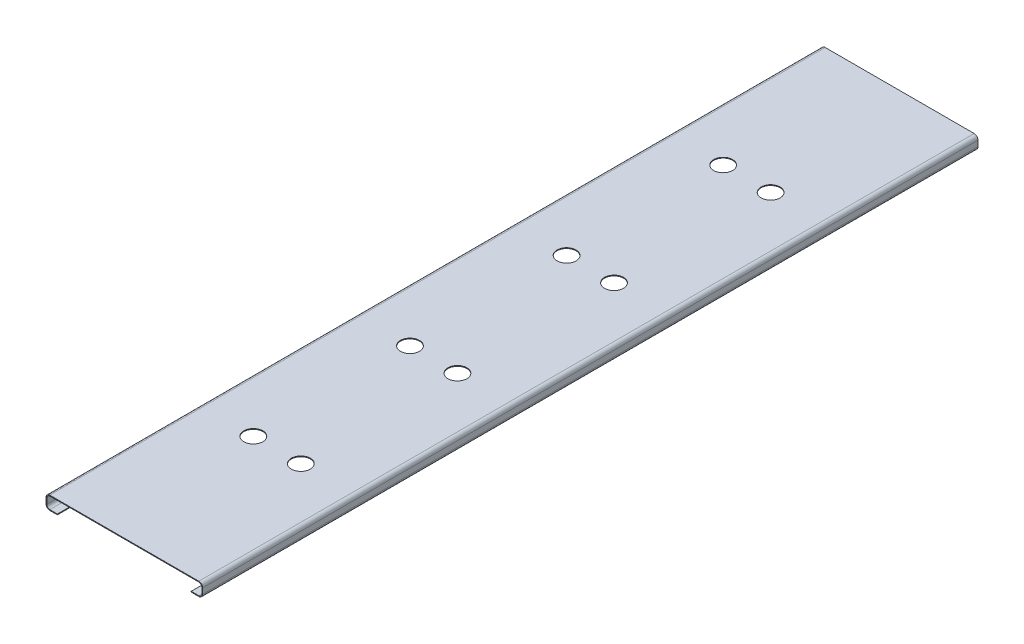
from build123d import *

# Parameters (mm, degrees)
BASE_FLANGE1_DEPTH = 817
SKETCH6_R          = 10
CUT_EXTRUDE1_DEPTH = 10


# Sheet-metal steps are written as plain solids
with BuildPart() as part:
    # Sketch1 → Base-Flange1 (new body)
    with BuildSketch(Plane.XY):
        with BuildLine():
            Line((12, 0), (4, 0))
            ThreePointArc((4, 0), (1.171572875, 1.171572875), (0, 4))
            Line((0, 4), (0, 10))
            ThreePointArc((0, 10), (1.171572875, 12.828427125), (4, 14))
            Line((4, 14), (161, 14))
            ThreePointArc((161, 14), (163.828427125, 12.828427125), (165, 10))
            Line((165, 10), (165, 4))
            ThreePointArc((165, 4), (163.828427125, 1.171572875), (161, 0))
            Line((161, 0), (153, 0))
            Line((153, 0), (153, 0.8))
            Line((153, 0.8), (161, 0.8))
            ThreePointArc((161, 0.8), (163.2627417, 1.7372583), (164.2, 4))
            Line((164.2, 4), (164.2, 10))
            ThreePointArc((164.2, 10), (163.2627417, 12.2627417), (161, 13.2))
            Line((161, 13.2), (4, 13.2))
            ThreePointArc((4, 13.2), (1.7372583, 12.2627417), (0.8, 10))
            Line((0.8, 10), (0.8, 4))
            ThreePointArc((0.8, 4), (1.7372583, 1.7372583), (4, 0.8))
            Line((4, 0.8), (12, 0.8))
            Line((12, 0.8), (12, 0))
        make_face()
    extrude(amount=BASE_FLANGE1_DEPTH)

    # Sketch6 → Cut-Extrude1 (cut)
    with BuildSketch(Plane(origin=(0, 14, 0), x_dir=(1, 0, 0), z_dir=(0, 1, 0))):
        with Locations(Location((107.5, -326, 0), (0, 0, 270))):
            Circle(SKETCH6_R)
        with Locations(Location((107.5, -161, 0), (0, 0, 270))):
            Circle(SKETCH6_R)
        with Locations(Location((107.5, -491, 0), (0, 0, 270))):
            Circle(SKETCH6_R)
        with Locations(Location((107.5, -656, 0), (0, 0, 270))):
            Circle(SKETCH6_R)
        with Locations(Location((57.5, -656, 0), (0, 0, 270))):
            Circle(SKETCH6_R)
        with Locations(Location((57.5, -491, 0), (0, 0, 270))):
            Circle(SKETCH6_R)
        with Locations(Location((57.5, -326, 0), (0, 0, 270))):
            Circle(SKETCH6_R)
        with Locations(Location((57.5, -161, 0), (0, 0, 270))):
            Circle(SKETCH6_R)
    extrude(amount=-CUT_EXTRUDE1_DEPTH, mode=Mode.SUBTRACT)


solid = part.part
